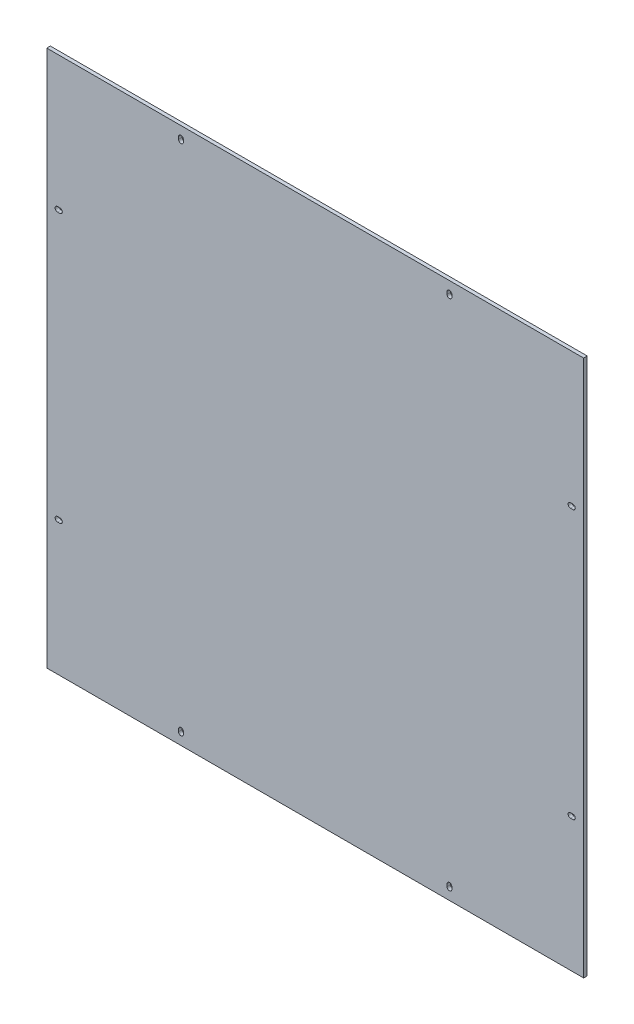
from build123d import *

# Parameters (mm, degrees)
SCHIZZO1_W                   = 448
SCHIZZO1_H                   = 448
ESTRUSIONE_ESTRUSIONE1_DEPTH = 3


with BuildPart() as part:
    # Schizzo1 → Estrusione-Estrusione1 (new body)
    with BuildSketch(Plane.XY):
        with Locations((224, 224)):
            Rectangle(SCHIZZO1_W, SCHIZZO1_H)
        with BuildLine():
            Line((9, 338), (11, 338))
            ThreePointArc((11, 338), (13, 336), (11, 334))
            Line((11, 334), (9, 334))
            ThreePointArc((9, 334), (7, 336), (9, 338))
        make_face(mode=Mode.SUBTRACT)
        with BuildLine():
            Line((9, 110), (11, 110))
            ThreePointArc((11, 110), (13, 112), (11, 114))
            Line((11, 114), (9, 114))
            ThreePointArc((9, 114), (7, 112), (9, 110))
        make_face(mode=Mode.SUBTRACT)
        with BuildLine():
            Line((439, 110), (437, 110))
            ThreePointArc((437, 110), (435, 112), (437, 114))
            Line((437, 114), (439, 114))
            ThreePointArc((439, 114), (441, 112), (439, 110))
        make_face(mode=Mode.SUBTRACT)
        with BuildLine():
            Line((439, 338), (437, 338))
            ThreePointArc((437, 338), (435, 336), (437, 334))
            Line((437, 334), (439, 334))
            ThreePointArc((439, 334), (441, 336), (439, 338))
        make_face(mode=Mode.SUBTRACT)
        with BuildLine():
            Line((114, 439), (114, 437))
            ThreePointArc((114, 437), (112, 435), (110, 437))
            Line((110, 437), (110, 439))
            ThreePointArc((110, 439), (112, 441), (114, 439))
        make_face(mode=Mode.SUBTRACT)
        with BuildLine():
            Line((334, 439), (334, 437))
            ThreePointArc((334, 437), (336, 435), (338, 437))
            Line((338, 437), (338, 439))
            ThreePointArc((338, 439), (336, 441), (334, 439))
        make_face(mode=Mode.SUBTRACT)
        with BuildLine():
            Line((114, 9), (114, 11))
            ThreePointArc((114, 11), (112, 13), (110, 11))
            Line((110, 11), (110, 9))
            ThreePointArc((110, 9), (112, 7), (114, 9))
        make_face(mode=Mode.SUBTRACT)
        with BuildLine():
            Line((334, 9), (334, 11))
            ThreePointArc((334, 11), (336, 13), (338, 11))
            Line((338, 11), (338, 9))
            ThreePointArc((338, 9), (336, 7), (334, 9))
        make_face(mode=Mode.SUBTRACT)
    extrude(amount=-ESTRUSIONE_ESTRUSIONE1_DEPTH)


solid = part.part
